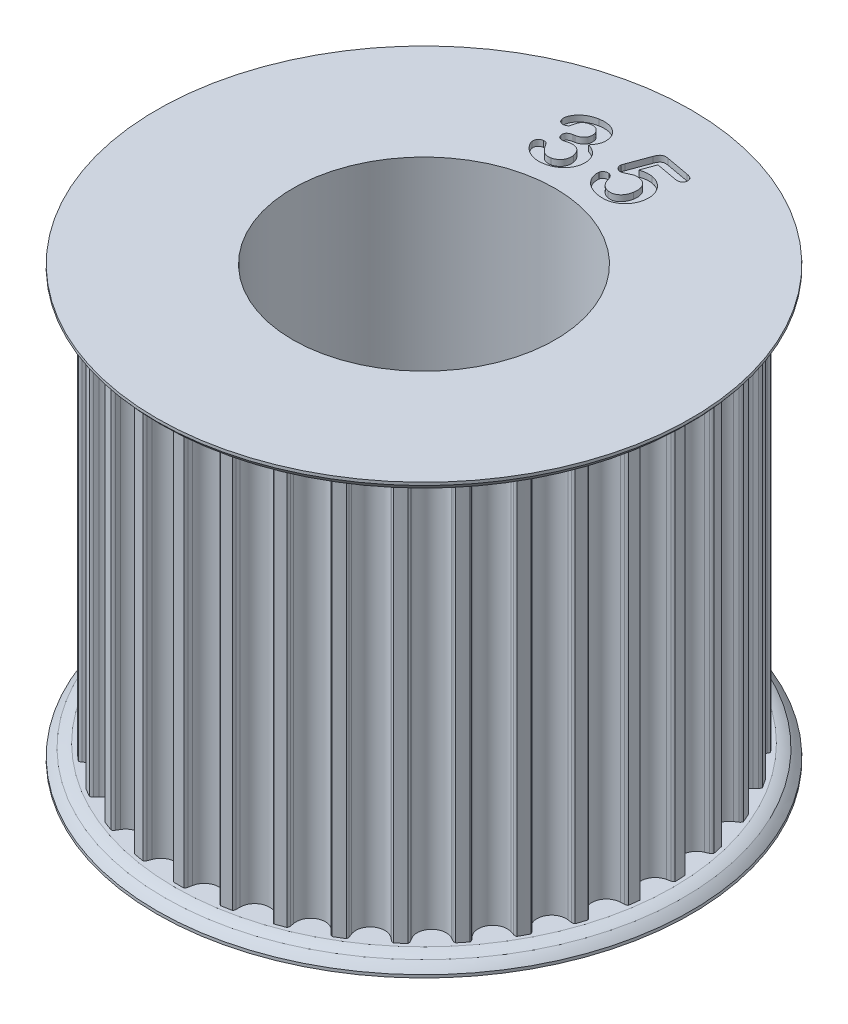
from build123d import *

# Parameters (mm, degrees)
SKETCH1_R                    = 16.330269559
TOOTHOD_DEPTH                = 13.335
TOOTHPROFILE_DEPTH           = 27.667913919
TOOTHPATTERN_COUNT           = 35
BORE_DEPTH                   = 29.920398618
BORE_DEPTH_BACK              = 29.920398618
SKETCH7_R                    = 8.73125
LARGE_TOOTH_COUNT_DEPTH      = 39.062940309
LARGE_TOOTH_COUNT_DEPTH_BACK = 0.4
SKETCH14_W                   = 12.7
SKETCH14_H                   = 2.8829


with BuildPart() as part:
    # Sketch1 → ToothOD (new, symmetric)
    with BuildSketch(Plane(origin=(0, 0, 0), x_dir=(1, 0, 0), z_dir=(0, 1, 0))):
        Circle(SKETCH1_R)
    extrude(amount=TOOTHOD_DEPTH, both=True)

    # Sketch2 → ToothProfile (cut, symmetric)
    with BuildSketch(Plane(origin=(0, 0, 0), x_dir=(1, 0, 0), z_dir=(0, 1, 0))):
        with BuildLine():
            ThreePointArc((-0.937033068, 15.880331555), (-0.590385173, 15.362156945), (0, 15.161869559))
            ThreePointArc((0, 15.161869559), (0.590385173, 15.362156945), (0.937033068, 15.880331555))
            ThreePointArc((0.937033068, 15.880331555), (0.971699064, 16.006443017), (1.007805813, 16.132149559))
            ThreePointArc((1.007805813, 16.132149559), (1.051151751, 16.221468776), (1.121297741, 16.291727817))
            ThreePointArc((1.121297741, 16.291727817), (0, 16.330269559), (-1.121297741, 16.291727817))
            ThreePointArc((-1.121297741, 16.291727817), (-1.051151751, 16.221468776), (-1.007805813, 16.132149559))
            ThreePointArc((-1.007805813, 16.132149559), (-0.971699064, 16.006443017), (-0.937033068, 15.880331555))
        make_face()
    toothprofile = extrude(amount=TOOTHPROFILE_DEPTH, both=True, mode=Mode.SUBTRACT)

    # ToothPattern: ToothProfile ×35 about axis
    toothpattern_axis = Axis((0, 13.335, 0), (0, -1, 0))
    for i in range(1, TOOTHPATTERN_COUNT):
        add(toothprofile.rotate(toothpattern_axis, i * 360 / TOOTHPATTERN_COUNT), mode=Mode.SUBTRACT)

    # Sketch4 → Flange (revolve)
    with BuildSketch(Plane.XY):
        with BuildLine():
            Line((0, -13.335), (16.584269559, -13.335))
            ThreePointArc((16.584269559, -13.335), (16.93729837, -13.437188662), (17.272, -13.589))
            ThreePointArc((17.272, -13.589), (17.540284982, -13.828715018), (17.78, -14.097))
            Line((17.78, -14.097), (17.78, -14.2875))
            Line((17.78, -14.2875), (0, -14.2875))
            Line((0, -14.2875), (0, -13.335))
        make_face()
        with BuildLine():
            Line((17.78, 14.2875), (17.78, 14.097))
            ThreePointArc((17.78, 14.097), (17.540284982, 13.828715018), (17.272, 13.589))
            ThreePointArc((17.272, 13.589), (16.93729837, 13.437188662), (16.584269559, 13.335))
            Line((16.584269559, 13.335), (0, 13.335))
            Line((0, 13.335), (0, 14.2875))
            Line((0, 14.2875), (17.78, 14.2875))
        make_face()
    revolve(axis=Axis((0, 8.73125, 0), (0, -1, 0)))

    # Sketch7 → Bore (cut, two sides: drawn at the far end of the back side and taken through both)
    with BuildSketch(Plane.XZ.offset(-BORE_DEPTH_BACK)):
        Circle(SKETCH7_R)
    extrude(amount=BORE_DEPTH + BORE_DEPTH_BACK, mode=Mode.SUBTRACT)

    # Sketch9 → Large Tooth Count (cut, two sides: drawn at the far end of the back side and taken through both)
    with BuildSketch(Plane(origin=(0, 14.2875, 0), x_dir=(1, 0, 0), z_dir=(0, 1, 0)).offset(-LARGE_TOOTH_COUNT_DEPTH_BACK)):
        with BuildLine():
            add(Edge.make_bspline(
                [(-2.395395166, 12.44030561), (-2.351764935, 12.449788273), (-2.26636482, 12.468349267), (-2.148342517, 12.521687794), (-2.042804555, 12.591006059), (-1.96740896, 12.663473497), (-1.915871931, 12.728738206), (-1.883660529, 12.781439315), (-1.858242003, 12.837454575), (-1.840411306, 12.896637263), (-1.829894588, 12.959037271), (-1.825356933, 13.024243133), (-1.828016507, 13.092828085), (-1.835316428, 13.138960651), (-1.839075635, 13.162717329)],
                knots=[0, 0, 0, 0, 1.56408417, 3.061477405, 4.516692484, 5.980328475, 6.71001621, 7.432406507, 8.143441474, 8.864242186, 9.596246751, 10.361021371, 11.155982632, 12, 12, 12, 12], degree=3))
            add(Edge.make_bspline(
                [(-1.839075635, 13.162717329), (-1.847468614, 13.198321462), (-1.863918276, 13.268103117), (-1.912945679, 13.363762957), (-1.979770738, 13.4477246), (-2.063508364, 13.518748482), (-2.161688264, 13.573950381), (-2.272366388, 13.606154076), (-2.39306776, 13.616531188), (-2.474963903, 13.604676737), (-2.517731885, 13.598486079)],
                knots=[0, 0, 0, 0, 0.970242947, 1.901609501, 2.831594879, 3.809017159, 4.805027202, 5.804681963, 6.853556249, 8, 8, 8, 8], degree=3))
            add(Edge.make_bspline(
                [(-2.517731885, 13.598486079), (-2.546415601, 13.592694971), (-2.601323677, 13.581609287), (-2.678208847, 13.55850786), (-2.746350603, 13.530836409), (-2.805384858, 13.497992457), (-2.855844248, 13.460479936), (-2.900373354, 13.421487835), (-2.937064484, 13.378096327), (-2.978986878, 13.315102944), (-3.020518734, 13.221832551), (-3.059478235, 13.098283973), (-3.093381877, 12.968046045), (-3.114639047, 12.880861708), (-3.124950635, 12.838569673)],
                knots=[0, 0, 0, 0, 0.994372717, 1.903487376, 2.72466848, 3.490292993, 4.192582868, 4.858964158, 5.497730828, 6.117954991, 7.426137334, 8.949273991, 10.520130824, 12, 12, 12, 12], degree=3))
            add(Edge.make_bspline(
                [(-3.124950635, 12.838569673), (-3.129102288, 12.828888525), (-3.137555782, 12.809176013), (-3.156946896, 12.781271911), (-3.184316211, 12.757087617), (-3.228365663, 12.724989234), (-3.296869514, 12.693279737), (-3.356792915, 12.679657358), (-3.388376416, 12.672477485)],
                knots=[0, 0, 0, 0, 0.583215557, 1.187529019, 1.864732099, 2.597558886, 4.206693834, 6, 6, 6, 6], degree=3))
            add(Edge.make_bspline(
                [(-3.388376416, 12.672477485), (-3.408006408, 12.670159859), (-3.447059185, 12.665549071), (-3.507022694, 12.67355228), (-3.566425146, 12.693523488), (-3.623655514, 12.725811297), (-3.677136394, 12.767570228), (-3.718303855, 12.823277744), (-3.750834042, 12.887407726), (-3.76148388, 12.935253341), (-3.766995166, 12.960013423)],
                knots=[0, 0, 0, 0, 0.895545026, 1.78163704, 2.722927117, 3.728259503, 4.757347425, 5.780279766, 6.851295854, 8, 8, 8, 8], degree=3))
            add(Edge.make_bspline(
                [(-3.766995166, 12.960013423), (-3.770411448, 12.985862618), (-3.777384046, 13.038620566), (-3.773919219, 13.121047331), (-3.759263587, 13.207335205), (-3.733005125, 13.296987906), (-3.696578666, 13.389099655), (-3.647932397, 13.480993304), (-3.588113382, 13.572735702), (-3.518084365, 13.664428947), (-3.436036471, 13.753650839), (-3.341843972, 13.838087605), (-3.234599648, 13.915677391), (-3.115927699, 13.987966339), (-2.986130398, 14.052791424), (-2.845920922, 14.108605922), (-2.695743201, 14.153101315), (-2.591436102, 14.174340706), (-2.538270166, 14.185166548)],
                knots=[0, 0, 0, 0, 0.657648442, 1.342253878, 2.074039585, 2.864148476, 3.697712609, 4.572156031, 5.485651204, 6.461680898, 7.483386968, 8.543039874, 9.651430748, 10.822328438, 12.049685541, 13.311901225, 14.629860395, 16, 16, 16, 16], degree=3))
            add(Edge.make_bspline(
                [(-2.538270166, 14.185166548), (-2.491323817, 14.192598445), (-2.399252753, 14.207173862), (-2.262542202, 14.218659249), (-2.130523977, 14.21615243), (-2.003510296, 14.205171913), (-1.88150585, 14.182798989), (-1.765492151, 14.149880101), (-1.655706619, 14.106812961), (-1.552939002, 14.053959346), (-1.457386459, 13.992879421), (-1.37142964, 13.922784448), (-1.294282136, 13.845573559), (-1.228614102, 13.759473777), (-1.172184525, 13.667230001), (-1.12544845, 13.569517), (-1.089148427, 13.465869789), (-1.073635459, 13.393899723), (-1.065764698, 13.357384517)],
                knots=[0, 0, 0, 0, 1.205963252, 2.365132143, 3.475536425, 4.552557823, 5.596986774, 6.617881568, 7.608112011, 8.584359298, 9.54600503, 10.480268389, 11.393565618, 12.30907766, 13.221030907, 14.133203077, 15.052849641, 16, 16, 16, 16], degree=3))
            add(Edge.make_bspline(
                [(-1.065764698, 13.357384517), (-1.058444517, 13.309874096), (-1.044223716, 13.217576343), (-1.046060272, 13.080838704), (-1.062999475, 12.95140843), (-1.100190083, 12.829006806), (-1.152753369, 12.710344301), (-1.218197892, 12.591451706), (-1.297956271, 12.471597027), (-1.359266437, 12.394328645), (-1.390805323, 12.35458061)],
                knots=[0, 0, 0, 0, 1.053632123, 2.04687467, 2.990381272, 3.91042597, 4.843946409, 5.835317206, 6.886454128, 8, 8, 8, 8], degree=3))
            add(Edge.make_bspline(
                [(-1.390805323, 12.35458061), (-1.350412041, 12.340545314), (-1.270980886, 12.312945681), (-1.157752588, 12.262979632), (-1.052586502, 12.206626181), (-0.956144809, 12.143795096), (-0.867013097, 12.07655175), (-0.788401054, 12.001417094), (-0.716721652, 11.921931915), (-0.655517404, 11.83490394), (-0.602231291, 11.742811281), (-0.559592513, 11.644667954), (-0.524881708, 11.541361692), (-0.509910371, 11.46953943), (-0.502301416, 11.43303686)],
                knots=[0, 0, 0, 0, 1.139891914, 2.24153439, 3.296229475, 4.31773043, 5.308329865, 6.268443975, 7.212979858, 8.157782482, 9.099914282, 10.045216846, 11.006511264, 12, 12, 12, 12], degree=3))
            add(Edge.make_bspline(
                [(-0.502301416, 11.43303686), (-0.495319451, 11.388490119), (-0.481414307, 11.299771707), (-0.478916202, 11.164667165), (-0.488260491, 11.029415833), (-0.51276627, 10.894860542), (-0.549846959, 10.762327063), (-0.602249742, 10.634138329), (-0.667869204, 10.510393731), (-0.746222597, 10.391484268), (-0.838347041, 10.280067973), (-0.942787724, 10.17663575), (-1.059215889, 10.081986318), (-1.186989884, 9.996266633), (-1.325681923, 9.920701304), (-1.475651654, 9.858916788), (-1.635068246, 9.806633217), (-1.746512528, 9.78436586), (-1.803356885, 9.773007954)],
                knots=[0, 0, 0, 0, 0.919196757, 1.830654129, 2.750292315, 3.682047259, 4.616530511, 5.553871909, 6.502170786, 7.470871317, 8.454707972, 9.446890999, 10.465768377, 11.511964047, 12.582837701, 13.682741819, 14.818036711, 16, 16, 16, 16], degree=3))
            add(Edge.make_bspline(
                [(-1.803356885, 9.773007954), (-1.861273881, 9.764095157), (-1.97457734, 9.746658985), (-2.143413115, 9.740832432), (-2.305966452, 9.751048954), (-2.461225746, 9.778889999), (-2.606979598, 9.821119725), (-2.742928406, 9.873090337), (-2.868308727, 9.934276457), (-2.981900004, 10.005903776), (-3.083286845, 10.085279788), (-3.175837052, 10.166704637), (-3.256567319, 10.253286516), (-3.326556915, 10.341337364), (-3.383639504, 10.428572924), (-3.428783069, 10.510279282), (-3.462785872, 10.585170072), (-3.474766814, 10.634802087), (-3.480352198, 10.657939985)],
                knots=[0, 0, 0, 0, 1.358988971, 2.658600414, 3.911700577, 5.132627013, 6.311151581, 7.428568411, 8.506776026, 9.543649576, 10.538503265, 11.492538343, 12.401569204, 13.281931069, 14.10006001, 14.817332809, 15.448653585, 16, 16, 16, 16], degree=3))
            add(Edge.make_bspline(
                [(-3.480352198, 10.657939985), (-3.483746984, 10.68497257), (-3.490277506, 10.736974917), (-3.483346924, 10.814189742), (-3.459407148, 10.885488216), (-3.420429227, 10.949801807), (-3.370073369, 11.006058136), (-3.308307685, 11.050542415), (-3.238271172, 11.084475844), (-3.186891971, 11.095909843), (-3.160669385, 11.101745454)],
                knots=[0, 0, 0, 0, 1.065165672, 2.049049875, 3.00773798, 3.985592617, 4.976224793, 5.944087156, 6.950716419, 8, 8, 8, 8], degree=3))
            add(Edge.make_bspline(
                [(-3.160669385, 11.101745454), (-3.132597094, 11.104682386), (-3.07565053, 11.110640153), (-3.005449066, 11.091014031), (-2.953679925, 11.068571016), (-2.91939304, 11.047595496), (-2.891337116, 11.023070197), (-2.877833025, 11.003226451), (-2.87134751, 10.993696235)],
                knots=[0, 0, 0, 0, 1.550673656, 3.145647615, 3.957272918, 4.675311549, 5.363801208, 6, 6, 6, 6], degree=3))
            add(Edge.make_bspline(
                [(-2.87134751, 10.993696235), (-2.834765451, 10.934439869), (-2.765769991, 10.822679615), (-2.654254449, 10.673931939), (-2.546873402, 10.549804547), (-2.454600564, 10.465849729), (-2.379391167, 10.412984746), (-2.320630434, 10.38270277), (-2.259082437, 10.358414541), (-2.19377006, 10.341195919), (-2.12514281, 10.331648111), (-2.053345183, 10.329022341), (-1.978350806, 10.333749213), (-1.927728345, 10.341432664), (-1.901583448, 10.345400923)],
                knots=[0, 0, 0, 0, 1.989651524, 3.75257504, 5.30775678, 6.675689646, 7.305821198, 7.929950262, 8.560368956, 9.193937615, 9.855728221, 10.536870827, 11.244340126, 12, 12, 12, 12], degree=3))
            add(Edge.make_bspline(
                [(-1.901583448, 10.345400923), (-1.871644399, 10.352199583), (-1.811653801, 10.36582245), (-1.724531025, 10.397969414), (-1.641916359, 10.442636299), (-1.563158271, 10.496780316), (-1.491100009, 10.561890428), (-1.427079449, 10.636365346), (-1.373201458, 10.72071369), (-1.328532708, 10.813025229), (-1.296080307, 10.912955075), (-1.279366413, 11.018302819), (-1.277092498, 11.127852865), (-1.287926429, 11.200953457), (-1.293471729, 11.238369673)],
                knots=[0, 0, 0, 0, 0.918783497, 1.841019456, 2.770121856, 3.724533536, 4.696473957, 5.670047891, 6.656552307, 7.685126467, 8.733743146, 9.79028542, 10.868967352, 12, 12, 12, 12], degree=3))
            add(Edge.make_bspline(
                [(-1.293471729, 11.238369673), (-1.298936686, 11.265876176), (-1.30961674, 11.319631579), (-1.333478309, 11.396401406), (-1.360287624, 11.468479114), (-1.394965812, 11.533732243), (-1.433076599, 11.593785038), (-1.476357011, 11.648422925), (-1.525805682, 11.69629192), (-1.579318811, 11.739547501), (-1.637253652, 11.775881164), (-1.698731759, 11.806115638), (-1.76434029, 11.827990482), (-1.83303783, 11.844288015), (-1.905487999, 11.853175874), (-1.98114044, 11.854782163), (-2.060573072, 11.849194939), (-2.114159971, 11.840923764), (-2.141792041, 11.836658735)],
                knots=[0, 0, 0, 0, 1.142167213, 2.232114242, 3.272952444, 4.271354239, 5.237162538, 6.16931723, 7.104388237, 8.036542928, 8.968855492, 9.885808178, 10.82190168, 11.781211808, 12.759285311, 13.790748962, 14.860800298, 16, 16, 16, 16], degree=3))
            add(Edge.make_bspline(
                [(-2.141792041, 11.836658735), (-2.152794304, 11.834231238), (-2.177762529, 11.828722342), (-2.219583134, 11.820746399), (-2.268450918, 11.806036359), (-2.322602613, 11.792515486), (-2.374969303, 11.777315582), (-2.420194021, 11.766479519), (-2.454197188, 11.756940782), (-2.473367184, 11.752663579), (-2.481120166, 11.750933735)],
                knots=[0, 0, 0, 0, 0.772488785, 1.753064323, 2.916415325, 4.267721891, 5.579625089, 6.653636691, 7.455485957, 8, 8, 8, 8], degree=3))
            add(Edge.make_bspline(
                [(-2.481120166, 11.750933735), (-2.506960456, 11.746913438), (-2.556158075, 11.739259148), (-2.627480161, 11.7445519), (-2.692385424, 11.758886393), (-2.748894318, 11.788116673), (-2.797532533, 11.827971419), (-2.835684342, 11.879578873), (-2.863495022, 11.941556302), (-2.873931957, 11.987031385), (-2.879384229, 12.010787642)],
                knots=[0, 0, 0, 0, 1.158395447, 2.205482207, 3.158342672, 4.093034092, 5.004217035, 5.930162721, 6.91871368, 8, 8, 8, 8], degree=3))
            add(Edge.make_bspline(
                [(-2.879384229, 12.010787642), (-2.882631581, 12.034581517), (-2.888938576, 12.080793902), (-2.878805561, 12.149340934), (-2.856720158, 12.213565122), (-2.817758689, 12.271771874), (-2.764205594, 12.323365118), (-2.69486753, 12.365228304), (-2.61067647, 12.39742537), (-2.548927529, 12.410824563), (-2.515945948, 12.417981392)],
                knots=[0, 0, 0, 0, 0.930670598, 1.807545321, 2.668967297, 3.556120476, 4.506850782, 5.542439393, 6.687358266, 8, 8, 8, 8], degree=3))
            Line((-2.515945948, 12.417981392), (-2.395395166, 12.44030561))
        make_face()
        with BuildLine():
            Line((3.470969531, 13.248778906), (2.066329687, 13.504167969))
            Line((2.066329687, 13.504167969), (1.722536719, 12.571015625))
            add(Edge.make_bspline(
                [(1.722536719, 12.571015625), (1.760221364, 12.582456499), (1.833907683, 12.604827305), (1.944336796, 12.63053201), (2.051309773, 12.650226874), (2.154991737, 12.664076405), (2.255550789, 12.670205817), (2.352759957, 12.670261918), (2.44682469, 12.664498512), (2.507806905, 12.65511005), (2.537817187, 12.650489844)],
                knots=[0, 0, 0, 0, 1.142763931, 2.234492753, 3.288447948, 4.298912865, 5.268366224, 6.210014718, 7.119120831, 8, 8, 8, 8], degree=3))
            add(Edge.make_bspline(
                [(2.537817187, 12.650489844), (2.584178142, 12.640654622), (2.675683927, 12.621242171), (2.808133204, 12.576982724), (2.933056107, 12.519770947), (3.050519267, 12.450735827), (3.15894209, 12.371254767), (3.259249995, 12.283505328), (3.348451885, 12.185707628), (3.427901479, 12.079960693), (3.498355062, 11.967671867), (3.555231362, 11.846806685), (3.602075256, 11.719636533), (3.636508349, 11.586197372), (3.658972332, 11.448431474), (3.66825767, 11.307557458), (3.661849221, 11.163899362), (3.647175322, 11.068343408), (3.639740625, 11.019928906)],
                knots=[0, 0, 0, 0, 1.036803612, 2.046410151, 3.049393204, 4.039468083, 5.023413739, 5.988188372, 6.951994443, 7.915007331, 8.880551716, 9.84811653, 10.83342035, 11.843258134, 12.859800031, 13.884826081, 14.928323294, 16, 16, 16, 16], degree=3))
            add(Edge.make_bspline(
                [(3.639740625, 11.019928906), (3.632622014, 10.985032557), (3.618547025, 10.91603515), (3.591995176, 10.814693757), (3.558687791, 10.717318488), (3.520292449, 10.623358324), (3.476409242, 10.532535897), (3.426481624, 10.445683796), (3.371683043, 10.36161049), (3.311035995, 10.281998201), (3.24648228, 10.205506018), (3.175034595, 10.136418517), (3.101478404, 10.070521754), (3.021855076, 10.011506302), (2.938587927, 9.957083451), (2.84997526, 9.908697027), (2.757740783, 9.864938722), (2.661003871, 9.827526105), (2.561172012, 9.796030925), (2.458353769, 9.7724799), (2.353256443, 9.753680033), (2.245394042, 9.744889903), (2.135369309, 9.74044435), (2.02298508, 9.74593976), (1.908096924, 9.755860254), (1.831114418, 9.768658863), (1.792188281, 9.775130469)],
                knots=[0, 0, 0, 0, 1.026016942, 2.028650872, 3.015798178, 3.988838367, 4.951544555, 5.919507516, 6.873310937, 7.840665881, 8.801536885, 9.753603835, 10.701529073, 11.644865729, 12.605851535, 13.565420493, 14.551337755, 15.54509359, 16.551388383, 17.564420898, 18.582341983, 19.624291376, 20.679670902, 21.752501611, 22.863554412, 24, 24, 24, 24], degree=3))
            add(Edge.make_bspline(
                [(1.792188281, 9.775130469), (1.749239381, 9.783661813), (1.66528631, 9.800338203), (1.543541762, 9.83151077), (1.429411264, 9.868069938), (1.322219421, 9.90921181), (1.222591776, 9.955469604), (1.129922603, 10.006104891), (1.045647626, 10.063054727), (0.944161405, 10.14227892), (0.834432297, 10.24779551), (0.723442899, 10.379568163), (0.638310051, 10.515051162), (0.579244448, 10.652089788), (0.543365439, 10.784415996), (0.519690175, 10.906414722), (0.51181234, 11.018370985), (0.520191252, 11.088435037), (0.524172656, 11.121727344)],
                knots=[0, 0, 0, 0, 1.028521656, 2.010471761, 2.950290147, 3.842387264, 4.705825736, 5.528968629, 6.320220492, 7.092332383, 8.551328728, 9.887092738, 11.130812689, 12.295941102, 13.378405623, 14.345302717, 15.213738161, 16, 16, 16, 16], degree=3))
            add(Edge.make_bspline(
                [(0.524172656, 11.121727344), (0.529153156, 11.140415021), (0.539252586, 11.17830979), (0.567528089, 11.23205124), (0.60917184, 11.280161487), (0.659110102, 11.324786273), (0.718044523, 11.359972313), (0.782512412, 11.383395677), (0.851403598, 11.390482967), (0.897185325, 11.384597731), (0.920650781, 11.38158125)],
                knots=[0, 0, 0, 0, 0.885800454, 1.796221264, 2.756418222, 3.792154177, 4.858077306, 5.886309467, 6.916626467, 8, 8, 8, 8], degree=3))
            add(Edge.make_bspline(
                [(0.920650781, 11.38158125), (0.940448194, 11.377086905), (0.979507271, 11.368219838), (1.034555002, 11.345372247), (1.082278286, 11.311681158), (1.126410335, 11.272621595), (1.162238181, 11.22301877), (1.195605759, 11.167601508), (1.219717377, 11.102173149), (1.232093336, 11.055748779), (1.238547656, 11.0315375)],
                knots=[0, 0, 0, 0, 0.965700083, 1.905266841, 2.813099893, 3.735740019, 4.696437521, 5.712290759, 6.806911863, 8, 8, 8, 8], degree=3))
            add(Edge.make_bspline(
                [(1.238547656, 11.0315375), (1.25143725, 10.986506821), (1.276549184, 10.89877656), (1.331960393, 10.776034146), (1.39965608, 10.665286764), (1.48116754, 10.568214961), (1.574449657, 10.487088145), (1.676234717, 10.420261719), (1.78862413, 10.372273214), (1.868037994, 10.354068316), (1.908274219, 10.344844531)],
                knots=[0, 0, 0, 0, 1.1049118, 2.15262577, 3.168933228, 4.161631001, 5.132996337, 6.07861344, 7.026500686, 8, 8, 8, 8], degree=3))
            add(Edge.make_bspline(
                [(1.908274219, 10.344844531), (1.945397274, 10.339098455), (2.017924258, 10.327872395), (2.126288096, 10.332952264), (2.230544657, 10.349649003), (2.329235236, 10.385668772), (2.422055672, 10.434678377), (2.508083733, 10.496903716), (2.584803783, 10.572815419), (2.654068669, 10.65987977), (2.713393825, 10.758287171), (2.763600761, 10.865943457), (2.803382942, 10.982713366), (2.820283284, 11.06464994), (2.828925, 11.106546875)],
                knots=[0, 0, 0, 0, 1.006771475, 1.966920522, 2.900356474, 3.833655398, 4.774461235, 5.71339597, 6.674743124, 7.665120328, 8.69509459, 9.754059421, 10.851574787, 12, 12, 12, 12], degree=3))
            add(Edge.make_bspline(
                [(2.828925, 11.106546875), (2.835751986, 11.15198937), (2.84890979, 11.23957171), (2.853888051, 11.368673464), (2.843478735, 11.489624098), (2.818334303, 11.602111951), (2.780807195, 11.704929283), (2.732867149, 11.798152939), (2.672134229, 11.879532214), (2.601029392, 11.949098968), (2.522074328, 12.00887603), (2.434848025, 12.055898969), (2.341049029, 12.092720551), (2.274951662, 12.106706151), (2.241351562, 12.113815625)],
                knots=[0, 0, 0, 0, 1.259489702, 2.427442772, 3.533727203, 4.579326063, 5.578659394, 6.527935786, 7.443775897, 8.349962228, 9.247838984, 10.150083194, 11.059608726, 12, 12, 12, 12], degree=3))
            add(Edge.make_bspline(
                [(2.241351562, 12.113815625), (2.201857689, 12.120525212), (2.128825249, 12.132932643), (2.026221847, 12.13937591), (1.939928102, 12.136441555), (1.86512377, 12.120283367), (1.794020003, 12.08993417), (1.711688534, 12.056316991), (1.616522977, 12.009674541), (1.512570025, 11.957578945), (1.408220242, 11.907276219), (1.309860105, 11.875517296), (1.223346718, 11.856228069), (1.170137033, 11.861404842), (1.145678906, 11.863784375)],
                knots=[0, 0, 0, 0, 1.251745807, 2.314740038, 3.209421319, 3.943316818, 4.691704647, 5.621704544, 6.724886191, 8.002691073, 9.260511675, 10.3377119, 11.235920032, 12, 12, 12, 12], degree=3))
            add(Edge.make_bspline(
                [(1.145678906, 11.863784375), (1.122112006, 11.869337636), (1.075655327, 11.880284602), (1.012103257, 11.914097841), (0.954679409, 11.958518633), (0.905838733, 12.014236185), (0.86663624, 12.076125476), (0.842097521, 12.141484034), (0.830932394, 12.207972204), (0.8359607, 12.2516301), (0.838497656, 12.273657031)],
                knots=[0, 0, 0, 0, 1.02701713, 2.024526124, 3.03594448, 4.104121318, 5.162632565, 6.137094895, 7.060099376, 8, 8, 8, 8], degree=3))
            add(Edge.make_bspline(
                [(0.838497656, 12.273657031), (0.840238838, 12.279624683), (0.845777584, 12.298607946), (0.859932806, 12.336661474), (0.879939922, 12.395879422), (0.896716185, 12.441874821), (0.906363281, 12.468324219)],
                knots=[0, 0, 0, 0, 0.361737259, 1.150696151, 2.361523671, 4, 4, 4, 4], degree=3))
            Line((0.906363281, 12.468324219), (1.411783594, 13.836352344))
            add(Edge.make_bspline(
                [(1.411783594, 13.836352344), (1.426336108, 13.87426178), (1.453747085, 13.945667631), (1.506310419, 14.040316237), (1.564919879, 14.116093164), (1.629764993, 14.175811038), (1.708022606, 14.216211112), (1.800060181, 14.235431493), (1.906129732, 14.237388095), (1.980115097, 14.226293964), (2.019895312, 14.220328906)],
                knots=[0, 0, 0, 0, 1.204741202, 2.269238945, 3.201003327, 4.039947967, 4.86613225, 5.781658433, 6.807249165, 8, 8, 8, 8], degree=3))
            Line((2.019895312, 14.220328906), (3.578125781, 13.937257812))
            add(Edge.make_bspline(
                [(3.578125781, 13.937257812), (3.613488335, 13.929812067), (3.679941406, 13.915820074), (3.770231467, 13.882757577), (3.84507809, 13.842281866), (3.90352319, 13.791875343), (3.946310041, 13.732780063), (3.970279481, 13.664089609), (3.979945084, 13.587747288), (3.972357606, 13.535378679), (3.968353125, 13.507739844)],
                knots=[0, 0, 0, 0, 1.309345376, 2.460512933, 3.475600575, 4.378501758, 5.238220283, 6.088669334, 6.991247718, 8, 8, 8, 8], degree=3))
            add(Edge.make_bspline(
                [(3.968353125, 13.507739844), (3.962891462, 13.483851233), (3.952215344, 13.437155263), (3.918139222, 13.374683143), (3.871864845, 13.321825441), (3.813364031, 13.279873957), (3.742833179, 13.249590732), (3.660928332, 13.235622797), (3.568729754, 13.233725484), (3.504817259, 13.243566928), (3.470969531, 13.248778906)],
                knots=[0, 0, 0, 0, 0.925869555, 1.809832167, 2.665883512, 3.571499722, 4.517323747, 5.551414743, 6.703241866, 8, 8, 8, 8], degree=3))
        make_face()
    extrude(amount=LARGE_TOOTH_COUNT_DEPTH + LARGE_TOOTH_COUNT_DEPTH_BACK, mode=Mode.SUBTRACT)

    # Sketch14 → Cut-Revolve1 (revolve, cut)
    with BuildSketch(Plane.XY):
        with Locations((6.35, -12.84605)):
            Rectangle(SKETCH14_W, SKETCH14_H)
    revolve(axis=Axis((0, 0, 0), (0, 1, 0)), mode=Mode.SUBTRACT)


solid = part.part
